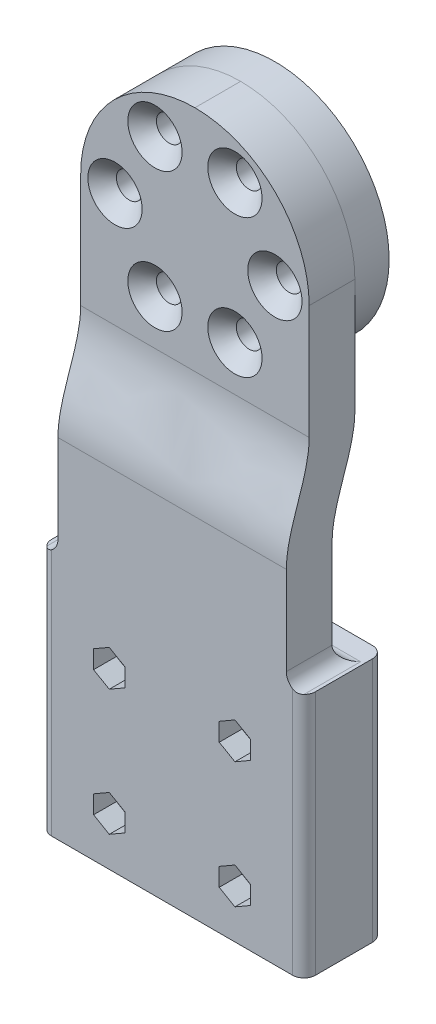
from build123d import *

# Parameters (mm, degrees)
SKETCH7_W           = 40
SKETCH7_H           = 40
BOSS_EXTRUDE1_DEPTH = 14
LOFT1_START         = -20
LOFT1_DEPTH         = 40
SKETCH16_W          = 49.026286786
SKETCH16_H          = 65.242270374
SKETCH16_R          = 20
CUT_EXTRUDE3_DEPTH  = 6
SKETCH17_W          = 40
SKETCH17_H          = 8
BOSS_EXTRUDE5_DEPTH = 18
SKETCH10_R          = 2.25
CUT_EXTRUDE1_DEPTH  = 25
CHAMFER1_SIZE       = 2.5
FILLET3_R           = 20
SKETCH11_W          = 46.2
SKETCH11_H          = 14
BOSS_EXTRUDE6_DEPTH = 43
FILLET9_R           = 2.5
SKETCH20_W          = 40.6
SKETCH20_H          = 4.4
CUT_EXTRUDE4_DEPTH  = 40
SKETCH22_R          = 1.7
CUT_EXTRUDE5_DEPTH  = 30
FILLET11_R          = 2
CUT_EXTRUDE6_DEPTH  = 4
SKETCH24_R          = 3
CUT_EXTRUDE7_DEPTH  = 3


# Read off the part's stored shape, not the designer's step: Loft1
with BuildPart() as part:
    # Sketch7 → Boss-Extrude1 (new body)
    with BuildSketch(Plane.XY):
        Rectangle(SKETCH7_W, SKETCH7_H)
    extrude(amount=BOSS_EXTRUDE1_DEPTH)

    # Loft1 outline → Loft1 (add)
    with BuildSketch(Plane.YZ.offset(LOFT1_START)):
        with BuildLine():
            add(Edge.make_bspline(
                [(-38, 18), (-31.853637028, 18), (-26.146362972, 14), (-20, 14)],
                knots=[0, 0, 0, 0, 1, 1, 1, 1], degree=3))
            Line((-38, 18), (-38, 10))
            add(Edge.make_bspline(
                [(-38, 10), (-31.853637028, 10), (-26.146362972, 6), (-20, 6)],
                knots=[0, 0, 0, 0, 1, 1, 1, 1], degree=3))
            Line((-20, 6), (-20, 14))
        make_face()
    extrude(amount=LOFT1_DEPTH)

    # Sketch16 → Cut-Extrude3 (cut)
    with BuildSketch(Plane(origin=(0, 0, 0), x_dir=(-1, 0, 0), z_dir=(0, 0, -1))):
        Rectangle(SKETCH16_W, SKETCH16_H)
        Circle(SKETCH16_R, mode=Mode.SUBTRACT)
    extrude(amount=-CUT_EXTRUDE3_DEPTH, mode=Mode.SUBTRACT)

    # Sketch17 → Boss-Extrude5 (add)
    with BuildSketch(Plane(origin=(0, -38, 0), x_dir=(-1, 0, 0), z_dir=(0, -1, 0))):
        with Locations((0, -14)):
            Rectangle(SKETCH17_W, SKETCH17_H)
    extrude(amount=BOSS_EXTRUDE5_DEPTH)

    # Sketch10 → Cut-Extrude1 (cut)
    with BuildSketch(Plane.XY.offset(14)):
        with Locations((-7.00009521, 12.124420806)):
            Circle(SKETCH10_R)
        with Locations((6.99990479, 12.124420806)):
            Circle(SKETCH10_R)
        with Locations((13.99990479, 6.5153e-05)):
            Circle(SKETCH10_R)
        with Locations((6.99990479, -12.1242905)):
            Circle(SKETCH10_R)
        with Locations((-7.00009521, -12.1242905)):
            Circle(SKETCH10_R)
        with Locations((-14.00009521, 6.5153e-05)):
            Circle(SKETCH10_R)
    extrude(amount=-CUT_EXTRUDE1_DEPTH, mode=Mode.SUBTRACT)

    # Chamfer1
    chamfer1_edges = [part.edges().sort_by_distance(p)[0] for p in [
        (4.74990479, 12.124420806, 14),
        (-9.25009521, 12.124420806, 14),
        (-16.25009521, 6.5153e-05, 14),
        (-9.25009521, -12.1242905, 14),
        (4.74990479, -12.1242905, 14),
        (11.74990479, 6.5153e-05, 14),
    ]]
    chamfer(chamfer1_edges, length=CHAMFER1_SIZE)

    # Fillet3
    fillet3_edges = [part.edges().sort_by_distance(p)[0] for p in [
        (20, 20, 10),
        (-20, 20, 10),
    ]]
    fillet(fillet3_edges, radius=FILLET3_R - 0.0001)  # a hair under: the kernel refuses the full size

    # Sketch11 → Boss-Extrude6 (add)
    with BuildSketch(Plane(origin=(0, -56, -3.472963553), x_dir=(1, 0, 0), z_dir=(0, 1, 0))):
        with Locations((0, -14.472963553)):
            Rectangle(SKETCH11_W, SKETCH11_H)
    extrude(amount=-BOSS_EXTRUDE6_DEPTH)

    # Fillet9
    fillet9_edges = [part.edges().sort_by_distance(p)[0] for p in [
        (0, -56, 10),
        (-20, -56, 14),
        (20, -56, 14),
    ]]
    fillet(fillet9_edges, radius=FILLET9_R)

    # Sketch20 → Cut-Extrude4 (cut)
    with BuildSketch(Plane.XZ.offset(99)):
        with Locations((0, 11)):
            Rectangle(SKETCH20_W, SKETCH20_H)
    extrude(amount=-CUT_EXTRUDE4_DEPTH, mode=Mode.SUBTRACT)

    # Sketch22 → Cut-Extrude5 (cut)
    with BuildSketch(Plane.XY):
        with Locations(Location((11, -68.5, 0), (0, 0, 180))):
            Circle(SKETCH22_R)
        with Locations(Location((11, -90.5, 0), (0, 0, 180))):
            Circle(SKETCH22_R)
        with Locations(Location((-11, -90.5, 0), (0, 0, 180))):
            Circle(SKETCH22_R)
        with Locations(Location((-11, -68.5, 0), (0, 0, 180))):
            Circle(SKETCH22_R)
    extrude(amount=CUT_EXTRUDE5_DEPTH, mode=Mode.SUBTRACT)

    # Fillet11
    fillet11_edges = [part.edges().sort_by_distance(p)[0] for p in [
        (-23.1, -77.5, 18),
        (-23.1, -77.5, 4),
        (23.1, -77.5, 18),
        (23.1, -77.5, 4),
    ]]
    fillet(fillet11_edges, radius=FILLET11_R)

    # Sketch23 → Cut-Extrude6 (cut)
    with BuildSketch(Plane.XY.offset(18)):
        Polygon((-11, -65.324573519), (-13.75, -66.91228676), (-13.75, -70.08771324), (-11, -71.675426481), (-8.25, -70.08771324), (-8.25, -66.91228676), align=None)
        Polygon((11, -65.324573519), (8.25, -66.91228676), (8.25, -70.08771324), (11, -71.675426481), (13.75, -70.08771324), (13.75, -66.91228676), align=None)
        Polygon((11, -87.324573519), (8.25, -88.91228676), (8.25, -92.08771324), (11, -93.675426481), (13.75, -92.08771324), (13.75, -88.91228676), align=None)
        Polygon((-11, -87.324573519), (-13.75, -88.91228676), (-13.75, -92.08771324), (-11, -93.675426481), (-8.25, -92.08771324), (-8.25, -88.91228676), align=None)
    extrude(amount=-CUT_EXTRUDE6_DEPTH, mode=Mode.SUBTRACT)

    # Sketch24 → Cut-Extrude7 (cut)
    with BuildSketch(Plane(origin=(0, 0, 4), x_dir=(-1, 0, 0), z_dir=(0, 0, -1))):
        with Locations((-11, -68.5)):
            Circle(SKETCH24_R)
        with Locations((11, -68.5)):
            Circle(SKETCH24_R)
        with Locations((11, -90.5)):
            Circle(SKETCH24_R)
        with Locations((-11, -90.5)):
            Circle(SKETCH24_R)
    extrude(amount=-CUT_EXTRUDE7_DEPTH, mode=Mode.SUBTRACT)


solid = part.part
